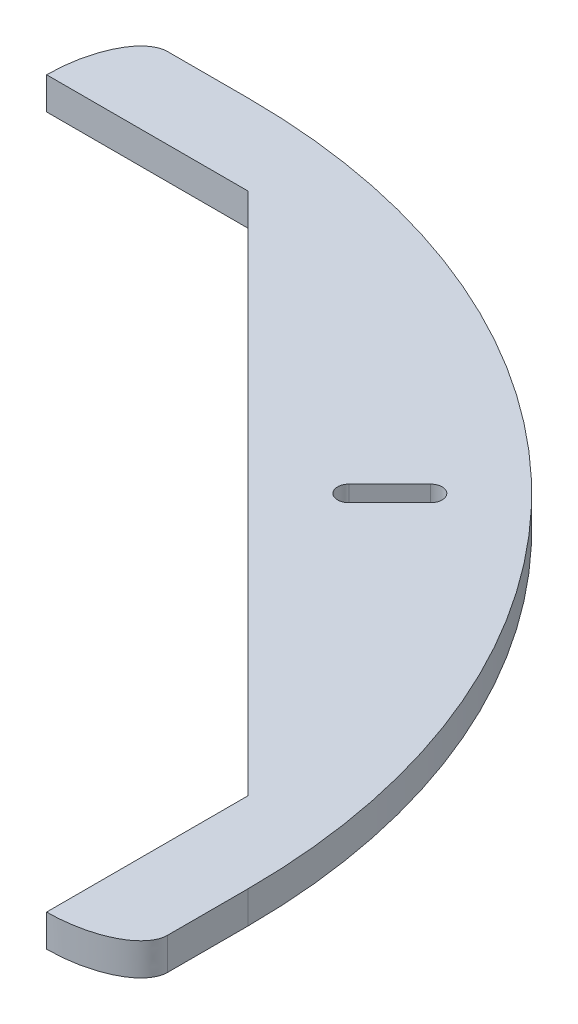
from build123d import *

# Parameters (mm, degrees)
BOSS_EXTRUDE1_DEPTH = 5.08
SKETCH2_W           = 12.7
SKETCH2_H           = 5.08
BOSS_EXTRUDE2_DEPTH = 6.35
FILLET3_SIZE        = 6.35
FILLET3_SIZE_2      = 12.7
FILLET4_SIZE        = 6.35
FILLET4_SIZE_2      = 12.7


with BuildPart() as part:
    # Sketch1 → Boss-Extrude1 (new body)
    with BuildSketch(Plane(origin=(0, 0, 0), x_dir=(1, 0, 0), z_dir=(0, 1, 0))):
        with BuildLine():
            Line((0, 120.65), (12.7, 120.65))
            ThreePointArc((12.7, 120.65), (89.032177029, 89.032177029), (120.65, 12.7))
            Line((120.65, 12.7), (120.65, 0))
            Line((120.65, 0), (107.95, 0))
            Line((107.95, 0), (107.95, 25.4))
            Line((107.95, 25.4), (25.4, 107.95))
            Line((25.4, 107.95), (0, 107.95))
            Line((0, 107.95), (0, 120.65))
        make_face()
        with BuildLine():
            Line((73.363460454, 75.909044866), (79.798132163, 82.343716575))
            ThreePointArc((79.798132163, 82.343716575), (82.343716575, 82.343716575), (82.343716575, 79.798132163))
            Line((82.343716575, 79.798132163), (75.909044866, 73.363460454))
            ThreePointArc((75.909044866, 73.363460454), (73.363460454, 73.363460454), (73.363460454, 75.909044866))
        make_face(mode=Mode.SUBTRACT)
    extrude(amount=BOSS_EXTRUDE1_DEPTH)

    # Sketch2 → Boss-Extrude2 (add)
    with BuildSketch(Plane.ZY):
        with Locations((-114.3, 2.54)):
            Rectangle(SKETCH2_W, SKETCH2_H)
    boss_extrude2 = extrude(amount=BOSS_EXTRUDE2_DEPTH)

    # Mirror2: Boss-Extrude2 across plane
    add(boss_extrude2.mirror(Plane(origin=(0, 0, 0), x_dir=(-0.7071067811865479, 0, 0.7071067811865471), z_dir=(0.7071067811865471, 0, 0.7071067811865479))))

    # Fillet3
    # an asymmetric fillet: 12.7, 6.35 mm, written as the material it takes off along each edge
    with BuildSketch(Plane(origin=(-6.35, 36.83, -120.65), x_dir=(1, 0, 0), z_dir=(0, -1, 0))) as fillet3_piece_1:
        with BuildLine():
            Bezier((FILLET3_SIZE, 0), (0, 0), (0, FILLET3_SIZE_2), weights=[1, 0.707106781, 1])
            Line((0, FILLET3_SIZE_2), (0, 0))
            Line((0, 0), (FILLET3_SIZE, 0))
        make_face()
    extrude(amount=68.58, mode=Mode.SUBTRACT)

    # Fillet4
    # an asymmetric fillet: 12.7, 6.35 mm, written as the material it takes off along each edge
    with BuildSketch(Plane(origin=(120.65, 36.83, 6.35), x_dir=(0, 0, -1), z_dir=(0, -1, 0))) as fillet4_piece_1:
        with BuildLine():
            Bezier((FILLET4_SIZE, 0), (0, 0), (0, -FILLET4_SIZE_2), weights=[1, 0.707106781, 1])
            Line((0, -FILLET4_SIZE_2), (0, 0))
            Line((0, 0), (FILLET4_SIZE, 0))
        make_face()
    extrude(amount=68.58, mode=Mode.SUBTRACT)


solid = part.part
